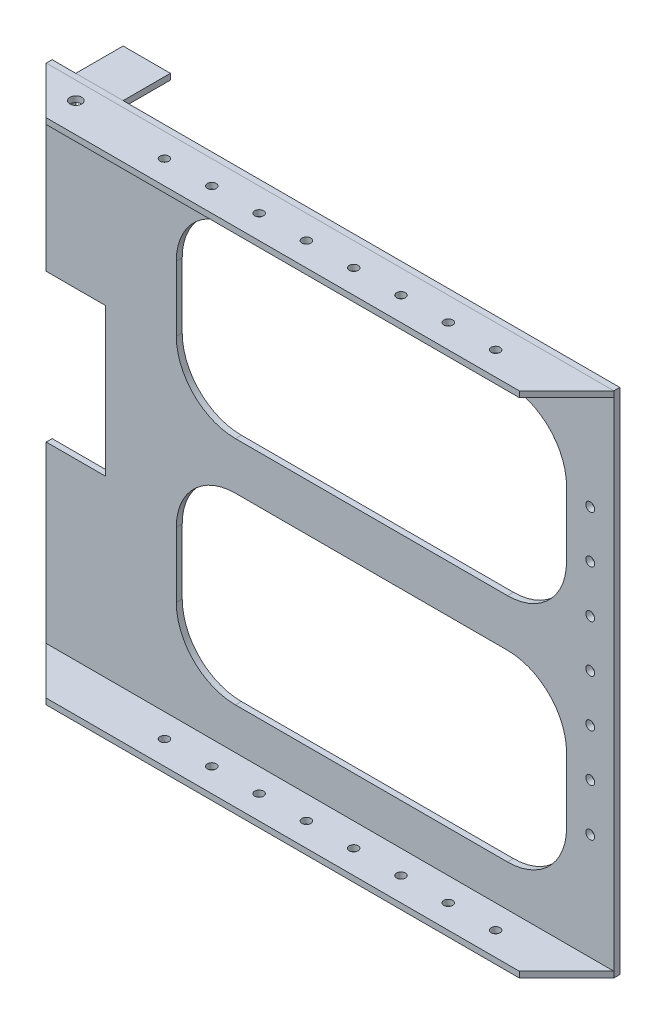
from build123d import *

# Parameters (mm, degrees)
SKETCH1_W           = 304.8
SKETCH1_H           = 273.05
BOSS_EXTRUDE1_DEPTH = 3.175
SKETCH2_W           = 31.75
SKETCH2_H           = 79.375
CUT_EXTRUDE1_DEPTH  = 3.175
SKETCH5_W           = 304.8
SKETCH5_H           = 3.175
BASE_FLANGE1_DEPTH  = 25.4
CHAMFER1_SIZE       = 25.4
SKETCH10_W          = 304.8
SKETCH10_H          = 3.175
BASE_FLANGE2_DEPTH  = 25.4
CHAMFER2_SIZE       = 25.4
SKETCH13_R          = 3.175
CUT_EXTRUDE4_DEPTH  = 3.175
SKETCH14_W          = 25.4
SKETCH14_H          = 3.175
BASE_FLANGE3_DEPTH  = 25.4
SKETCH18_W          = 25.4
SKETCH18_H          = 12.7
CUT_EXTRUDE5_DEPTH  = 3.175
SKETCH19_R          = 2.38125
CUT_EXTRUDE7_DEPTH  = 411.214423351
SKETCH20_R          = 2.38125
CUT_EXTRUDE8_DEPTH  = 50.8


# Sheet-metal steps are written as plain solids
with BuildPart() as part:
    # Sketch1 → Boss-Extrude1 (new body)
    with BuildSketch(Plane.XY):
        with Locations((152.4, 136.525)):
            Rectangle(SKETCH1_W, SKETCH1_H)
    extrude(amount=BOSS_EXTRUDE1_DEPTH)

    # Sketch2 → Cut-Extrude1 (cut)
    with BuildSketch(Plane.XY.offset(3.175)):
        with BuildLine():
            Line((101.6, 247.65), (247.65, 247.65))
            ThreePointArc((247.65, 247.65), (270.100640303, 238.350640303), (279.4, 215.9))
            Line((279.4, 215.9), (279.4, 180.975))
            ThreePointArc((279.4, 180.975), (270.100640303, 158.524359697), (247.65, 149.225))
            Line((247.65, 149.225), (101.6, 149.225))
            ThreePointArc((101.6, 149.225), (79.149359697, 158.524359697), (69.85, 180.975))
            Line((69.85, 180.975), (69.85, 215.9))
            ThreePointArc((69.85, 215.9), (79.149359697, 238.350640303), (101.6, 247.65))
        make_face()
        with BuildLine():
            Line((101.6, 123.825), (247.65, 123.825))
            ThreePointArc((247.65, 123.825), (270.100640303, 114.525640303), (279.4, 92.075))
            Line((279.4, 92.075), (279.4, 57.15))
            ThreePointArc((279.4, 57.15), (270.100640303, 34.699359697), (247.65, 25.4))
            Line((247.65, 25.4), (101.6, 25.4))
            ThreePointArc((101.6, 25.4), (79.149359697, 34.699359697), (69.85, 57.15))
            Line((69.85, 57.15), (69.85, 92.075))
            ThreePointArc((69.85, 92.075), (79.149359697, 114.525640303), (101.6, 123.825))
        make_face()
        with Locations((15.875, 136.525)):
            Rectangle(SKETCH2_W, SKETCH2_H)
    extrude(amount=-CUT_EXTRUDE1_DEPTH, mode=Mode.SUBTRACT)

    # Sketch18 → Cut-Extrude5 (cut)
    with BuildSketch(Plane(origin=(0, 0, 0), x_dir=(-1, 0, 0), z_dir=(0, 0, -1))):
        with Locations((-25.4, 263.525)):
            Rectangle(SKETCH18_W, SKETCH18_H)
    extrude(amount=-CUT_EXTRUDE5_DEPTH, mode=Mode.SUBTRACT)

    # Sketch20 → Cut-Extrude8 (cut)
    with BuildSketch(Plane(origin=(0, 0, 0), x_dir=(-1, 0, 0), z_dir=(0, 0, -1))):
        with Locations((-292.1, 136.525)):
            Circle(SKETCH20_R)
        with Locations((-292.1, 161.925)):
            Circle(SKETCH20_R)
        with Locations((-292.1, 187.325)):
            Circle(SKETCH20_R)
        with Locations((-292.1, 212.725)):
            Circle(SKETCH20_R)
        with Locations((-292.1, 111.125)):
            Circle(SKETCH20_R)
        with Locations((-292.1, 85.725)):
            Circle(SKETCH20_R)
        with Locations((-292.1, 60.325)):
            Circle(SKETCH20_R)
    extrude(amount=-CUT_EXTRUDE8_DEPTH, mode=Mode.SUBTRACT)


with BuildPart() as body_2:
    # Sketch5 → Base-Flange1 (new body)
    with BuildSketch(Plane.XY.offset(3.175)):
        with Locations((152.4, 271.4625)):
            Rectangle(SKETCH5_W, SKETCH5_H)
    extrude(amount=BASE_FLANGE1_DEPTH)

    # Chamfer1
    chamfer1_edges = [body_2.edges().sort_by_distance(p)[0] for p in [
        (0, 271.4625, 28.575),
        (304.8, 271.4625, 28.575),
    ]]
    chamfer(chamfer1_edges, length=CHAMFER1_SIZE - 0.0001)  # a hair under: the kernel refuses the full size

    # Sketch13 → Cut-Extrude4 (cut)
    with BuildSketch(Plane(origin=(0, 273.05, 0), x_dir=(1, 0, 0), z_dir=(0, 1, 0))):
        with Locations(Location((25.4, -12.7, 0), (0, 0, 270))):
            Circle(SKETCH13_R)
    extrude(amount=-CUT_EXTRUDE4_DEPTH, mode=Mode.SUBTRACT)


with BuildPart() as body_3:
    # Sketch10 → Base-Flange2 (new body)
    with BuildSketch(Plane.XY.offset(3.175)):
        with Locations((152.4, 1.5875)):
            Rectangle(SKETCH10_W, SKETCH10_H)
    extrude(amount=BASE_FLANGE2_DEPTH)

    # Chamfer2
    chamfer2_edges = [body_3.edges().sort_by_distance(p)[0] for p in [
        (0, 1.5875, 28.575),
        (304.8, 1.5875, 28.575),
    ]]
    chamfer(chamfer2_edges, length=CHAMFER2_SIZE - 0.0001)  # a hair under: the kernel refuses the full size


with BuildPart() as body_4:
    # Sketch14 → Base-Flange3 (new body)
    with BuildSketch(Plane(origin=(0, 0, 0), x_dir=(-1, 0, 0), z_dir=(0, 0, -1))):
        with Locations((-25.4, 271.4625)):
            Rectangle(SKETCH14_W, SKETCH14_H)
    extrude(amount=BASE_FLANGE3_DEPTH)


with BuildPart() as cut_extrude7_tool:
    # Sketch19 → Cut-Extrude7 (new, through all)
    with BuildSketch(Plane(origin=(0, 273.05, 0), x_dir=(1, 0, 0), z_dir=(0, 1, 0))):
        with Locations(Location((76.2, -15.875, 0), (0, 0, 270))):
            Circle(SKETCH19_R)
        with Locations(Location((101.6, -15.875, 0), (0, 0, 270))):
            Circle(SKETCH19_R)
        with Locations(Location((127, -15.875, 0), (0, 0, 270))):
            Circle(SKETCH19_R)
        with Locations(Location((152.4, -15.875, 0), (0, 0, 270))):
            Circle(SKETCH19_R)
        with Locations(Location((177.8, -15.875, 0), (0, 0, 270))):
            Circle(SKETCH19_R)
        with Locations(Location((203.2, -15.875, 0), (0, 0, 270))):
            Circle(SKETCH19_R)
        with Locations(Location((228.6, -15.875, 0), (0, 0, 270))):
            Circle(SKETCH19_R)
        with Locations(Location((254, -15.875, 0), (0, 0, 270))):
            Circle(SKETCH19_R)
    extrude(amount=-CUT_EXTRUDE7_DEPTH)


with BuildPart() as body_2_1:
    add(body_2.part)

    # Cut-Extrude7: cut by cut_extrude7_tool
    add(cut_extrude7_tool.part, mode=Mode.SUBTRACT)


with BuildPart() as body_3_1:
    add(body_3.part)

    # Cut-Extrude7: cut by cut_extrude7_tool
    add(cut_extrude7_tool.part, mode=Mode.SUBTRACT)


solid = Compound([part.part, body_4.part, body_2_1.part, body_3_1.part])
